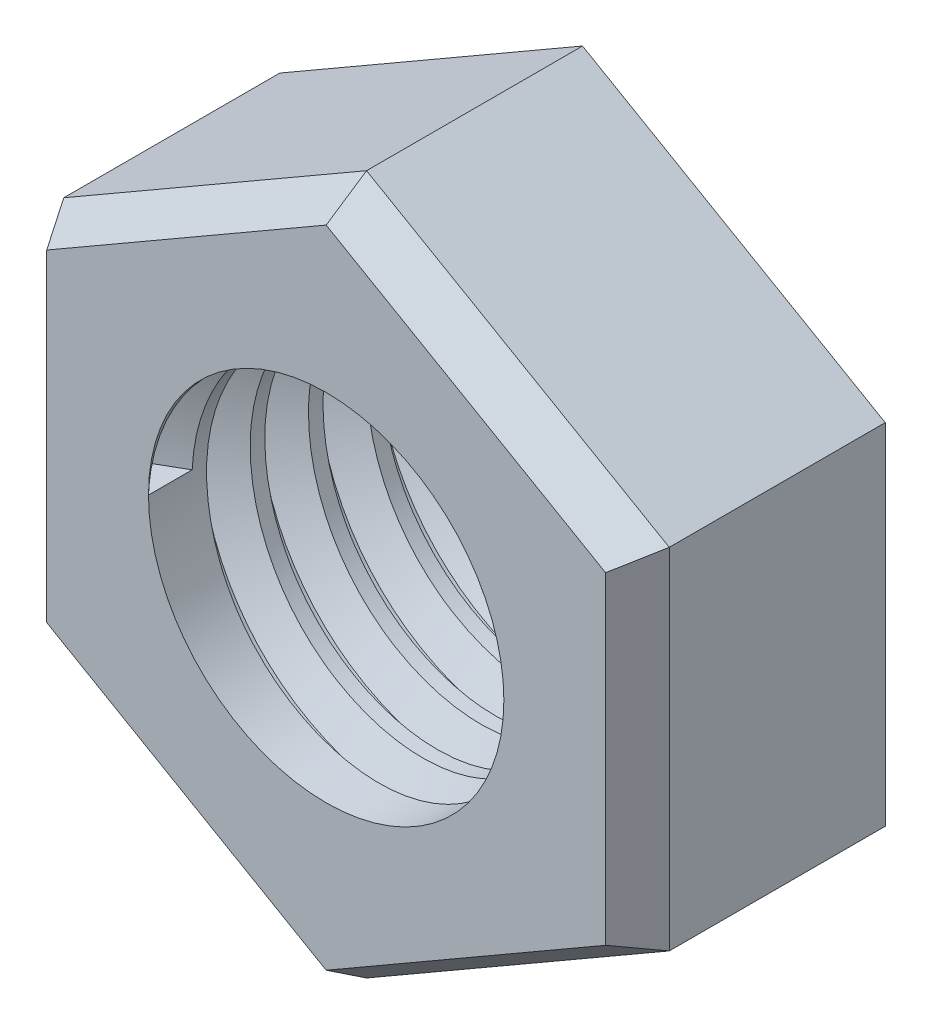
from build123d import *
from OCP.BRepFilletAPI import BRepFilletAPI_MakeChamfer

# Parameters (mm, degrees)
EXTRUDE_1_DEPTH     = 2.4
SKETCH_3_R          = 1.525
CUT_EXTRUDE_2_DEPTH = 5.63788745
THREAD_2_PITCH      = 0.5
CHAMFER_1_SIZE      = 0.2
CHAMFER_1_SIZE2     = 0.346410162


with BuildPart() as part:
    # Sketch 2 → Бобышка-Вытянуть1 (new body)
    with BuildSketch(Plane.XY):
        Polygon((0, 3), (-2.598076211, 1.5), (-2.598076211, -1.5), (0, -3), (2.598076211, -1.5), (2.598076211, 1.5), align=None)
    extrude(amount=EXTRUDE_1_DEPTH)

    # Эскиз3 → Вырез-Вытянуть2 (cut, through all)
    with BuildSketch(Plane.XY.offset(2.4)):
        Circle(SKETCH_3_R)
    extrude(amount=-CUT_EXTRUDE_2_DEPTH, mode=Mode.SUBTRACT)

    # Резьба2: the profile of Sketch 2 2 profile screwed along a right-hand helix of 4.8 turns, 6 arcs to a turn; built about Z, then put on its axis
    thread_2_z = Axis((0, 0, 0), (0, 0, 1))
    thread_2_corners = [(1.5247, 0, -0.000173205), (1.795632937, 0, 0.156249999), (1.795632937, 0, 0.218749999), (1.5247, 0, 0.375173204)]
    with BuildLine(mode=Mode.PRIVATE) as thread_2_profile:
        Line(thread_2_corners[0], thread_2_corners[1])
        Line(thread_2_corners[1], thread_2_corners[2])
        Line(thread_2_corners[2], thread_2_corners[3])
        Line(thread_2_corners[3], thread_2_corners[0])
    thread_2_cap = Face(thread_2_profile.wire())
    thread_2_turn_angles = [0, 30, 60, 90, 120, 150, 180, 210, 240, 270, 300, 330, 360]
    thread_2_turn_weights = [1, 0.8660254037844387, 1, 0.8660254037844387, 1, 0.8660254037844387, 1, 0.8660254037844387, 1, 0.8660254037844387, 1, 0.8660254037844387, 1]
    thread_2_turn_rails = [Edge.make_bspline([Vector(p[0], p[1], 0).rotate(thread_2_z, thread_2_turn_angles[k]) / thread_2_turn_weights[k] + Vector(0, 0, p[2] + THREAD_2_PITCH * thread_2_turn_angles[k] / 360) for k in range(13)], [0, 0, 0, 1, 1, 2, 2, 3, 3, 4, 4, 5, 5, 6, 6, 6], 2, thread_2_turn_weights) for p in thread_2_corners]
    thread_2_turn_sides = [Face.make_surface_from_curves(thread_2_turn_rails[p[0]], thread_2_turn_rails[p[1]]) for p in [(0, 1), (1, 2), (2, 3), (3, 0)]]
    thread_2_last_angles = [1440, 1470, 1500, 1530, 1560, 1590, 1620, 1650, 1680, 1704, 1728]
    thread_2_last_weights = [1, 0.8660254037844387, 1, 0.8660254037844387, 1, 0.8660254037844387, 1, 0.8660254037844387, 1, 0.9135454576426009, 1]
    thread_2_last_rails = [Edge.make_bspline([Vector(p[0], p[1], 0).rotate(thread_2_z, thread_2_last_angles[k]) / thread_2_last_weights[k] + Vector(0, 0, p[2] + THREAD_2_PITCH * thread_2_last_angles[k] / 360) for k in range(11)], [0, 0, 0, 1, 1, 2, 2, 3, 3, 4, 4, 5, 5, 5], 2, thread_2_last_weights) for p in thread_2_corners]
    thread_2_last_sides = [Face.make_surface_from_curves(thread_2_last_rails[p[0]], thread_2_last_rails[p[1]]) for p in [(0, 1), (1, 2), (2, 3), (3, 0)]]
    thread_2 = Plane(origin=(0, 0, 2.4), x_dir=(-1, 0, 0), z_dir=(0, 0, -1)) * Solid(Shell([*[p.moved(Location((0, 0, THREAD_2_PITCH * i))) for i in range(4) for p in thread_2_turn_sides], *thread_2_last_sides, thread_2_cap, thread_2_cap.rotate(thread_2_z, 1728).moved(Location((0, 0, THREAD_2_PITCH * 1728 / 360)))]))
    add(thread_2, mode=Mode.SUBTRACT)

    # Фаска1: one chamfer whose edges measure the first distance from different faces: ONE call of the kernel's chamfer builder (chamfer() names one face for all edges)
    chamfer_1_edges_1 = [part.edges().sort_by_distance(p)[0] for p in [
        (-2.598076211, 0, 2.4),
        (-1.299038106, -2.25, 2.4),
        (1.299038106, -2.25, 2.4),
        (2.598076211, 0, 2.4),
        (1.299038106, 2.25, 2.4),
        (-1.299038106, 2.25, 2.4),
    ]]
    chamfer_1_side_1 = [part.faces().sort_by_distance(p)[0] for p in [
        (-1.259351836, 2.181261365, 2.4),
    ]]
    chamfer_1_edges_2 = [part.edges().sort_by_distance(p)[0] for p in [
        (2.598076211, 0, 0),
    ]]
    chamfer_1_side_2 = [part.faces().sort_by_distance(p)[0] for p in [
        (2.598076211, 0, 1.2),
    ]]
    chamfer_1_edges_3 = [part.edges().sort_by_distance(p)[0] for p in [
        (1.299038106, -2.25, 0),
    ]]
    chamfer_1_side_3 = [part.faces().sort_by_distance(p)[0] for p in [
        (1.299038106, -2.25, 1.2),
    ]]
    chamfer_1_edges_4 = [part.edges().sort_by_distance(p)[0] for p in [
        (-1.299038106, -2.25, 0),
    ]]
    chamfer_1_side_4 = [part.faces().sort_by_distance(p)[0] for p in [
        (-1.299038106, -2.25, 1.2),
    ]]
    chamfer_1_edges_5 = [part.edges().sort_by_distance(p)[0] for p in [
        (-2.598076211, 0, 0),
    ]]
    chamfer_1_side_5 = [part.faces().sort_by_distance(p)[0] for p in [
        (-2.598076211, 0, 1.2),
    ]]
    chamfer_1_edges_6 = [part.edges().sort_by_distance(p)[0] for p in [
        (-1.299038106, 2.25, 0),
    ]]
    chamfer_1_side_6 = [part.faces().sort_by_distance(p)[0] for p in [
        (-1.299038106, 2.25, 1.2),
    ]]
    chamfer_1_edges_7 = [part.edges().sort_by_distance(p)[0] for p in [
        (1.299038106, 2.25, 0),
    ]]
    chamfer_1_side_7 = [part.faces().sort_by_distance(p)[0] for p in [
        (1.299038106, 2.25, 1.2),
    ]]
    chamfer_1 = BRepFilletAPI_MakeChamfer(part.part.solid().wrapped)
    for e in chamfer_1_edges_1:
        chamfer_1.Add(CHAMFER_1_SIZE, CHAMFER_1_SIZE2, e.wrapped, chamfer_1_side_1[0].wrapped)  # the first distance lies on this face
    for e in chamfer_1_edges_2:
        chamfer_1.Add(CHAMFER_1_SIZE, CHAMFER_1_SIZE2, e.wrapped, chamfer_1_side_2[0].wrapped)  # the first distance lies on this face
    for e in chamfer_1_edges_3:
        chamfer_1.Add(CHAMFER_1_SIZE, CHAMFER_1_SIZE2, e.wrapped, chamfer_1_side_3[0].wrapped)  # the first distance lies on this face
    for e in chamfer_1_edges_4:
        chamfer_1.Add(CHAMFER_1_SIZE, CHAMFER_1_SIZE2, e.wrapped, chamfer_1_side_4[0].wrapped)  # the first distance lies on this face
    for e in chamfer_1_edges_5:
        chamfer_1.Add(CHAMFER_1_SIZE, CHAMFER_1_SIZE2, e.wrapped, chamfer_1_side_5[0].wrapped)  # the first distance lies on this face
    for e in chamfer_1_edges_6:
        chamfer_1.Add(CHAMFER_1_SIZE, CHAMFER_1_SIZE2, e.wrapped, chamfer_1_side_6[0].wrapped)  # the first distance lies on this face
    for e in chamfer_1_edges_7:
        chamfer_1.Add(CHAMFER_1_SIZE, CHAMFER_1_SIZE2, e.wrapped, chamfer_1_side_7[0].wrapped)  # the first distance lies on this face
    add(Compound.cast(chamfer_1.Shape()), mode=Mode.REPLACE)


solid = part.part
